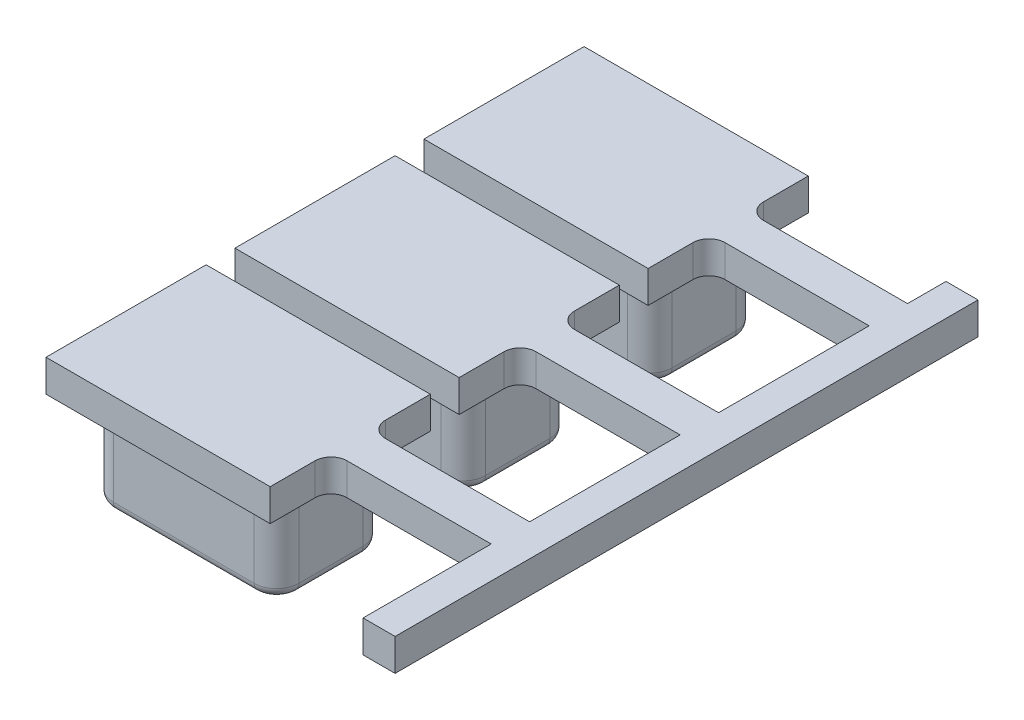
from build123d import *

# Parameters (mm, degrees)
EXTRUDE_1_DEPTH   = 4
EXTRUDE_1_2_DEPTH = 4
EXTRUDE_1_3_DEPTH = 4
SKETCH_2_W        = 7
SKETCH_2_H        = 5
EXTRUDE_2_DEPTH   = 1
SKETCH_3_W        = 6
SKETCH_3_H        = 1.2
EXTRUDE_3_DEPTH   = 1
SKETCH_4_W        = 1
SKETCH_4_H        = 13
EXTRUDE_4_DEPTH   = 1
FILLET_1_R        = 0.5
SKETCH_5_W        = 1
SKETCH_5_H        = 1
EXTRUDE_5_DEPTH   = 1.2
FILLET_2_R        = 0.3
SKETCH_7_W        = 1
SKETCH_7_H        = 1
EXTRUDE_6_DEPTH   = 4


with BuildPart() as part:
    # 草图1 → 凸台-拉伸1 (new body)
    with BuildSketch(Plane(origin=(0, 0, 0), x_dir=(1, 0, 0), z_dir=(0, 1, 0))):
        with BuildLine():
            Line((-2.2, 1.7), (2.2, 1.7))
            ThreePointArc((2.2, 1.7), (2.694974747, 1.494974747), (2.9, 1))
            Line((2.9, 1), (2.9, -1))
            ThreePointArc((2.9, -1), (2.694974747, -1.494974747), (2.2, -1.7))
            Line((2.2, -1.7), (-2.2, -1.7))
            ThreePointArc((-2.2, -1.7), (-2.694974747, -1.494974747), (-2.9, -1))
            Line((-2.9, -1), (-2.9, 1))
            ThreePointArc((-2.9, 1), (-2.694974747, 1.494974747), (-2.2, 1.7))
        make_face()
    extrude(amount=EXTRUDE_1_DEPTH)



with BuildPart() as body_2:
    # 草图1 → Extrude 1 2 (new body)
    with BuildSketch(Plane(origin=(0, 0, 0), x_dir=(1, 0, 0), z_dir=(0, 1, 0))):
        with BuildLine():
            Line((-2.2, 7.528722779), (2.2, 7.528722779))
            ThreePointArc((2.2, 7.528722779), (2.694974747, 7.323697526), (2.9, 6.828722779))
            Line((2.9, 6.828722779), (2.9, 4.828722779))
            ThreePointArc((2.9, 4.828722779), (2.694974747, 4.333748032), (2.2, 4.128722779))
            Line((2.2, 4.128722779), (-2.2, 4.128722779))
            ThreePointArc((-2.2, 4.128722779), (-2.694974747, 4.333748032), (-2.9, 4.828722779))
            Line((-2.9, 4.828722779), (-2.9, 6.828722779))
            ThreePointArc((-2.9, 6.828722779), (-2.694974747, 7.323697526), (-2.2, 7.528722779))
        make_face()
    extrude(amount=EXTRUDE_1_2_DEPTH)


with BuildPart() as body_3:
    # 草图1 → Extrude 1 3 (new body)
    with BuildSketch(Plane(origin=(0, 0, 0), x_dir=(1, 0, 0), z_dir=(0, 1, 0))):
        with BuildLine():
            Line((-2.2, 13.349128593), (2.2, 13.349128593))
            ThreePointArc((2.2, 13.349128593), (2.694974747, 13.144103339), (2.9, 12.649128593))
            Line((2.9, 12.649128593), (2.9, 10.649128593))
            ThreePointArc((2.9, 10.649128593), (2.694974747, 10.154153846), (2.2, 9.949128593))
            Line((2.2, 9.949128593), (-2.2, 9.949128593))
            ThreePointArc((-2.2, 9.949128593), (-2.694974747, 10.154153846), (-2.9, 10.649128593))
            Line((-2.9, 10.649128593), (-2.9, 12.649128593))
            ThreePointArc((-2.9, 12.649128593), (-2.694974747, 13.144103339), (-2.2, 13.349128593))
        make_face()
    extrude(amount=EXTRUDE_1_3_DEPTH)


with BuildPart() as part_1:
    add(part.part)

    add(body_2.part)  # 凸台-拉伸2 merges body 2

    add(body_3.part)  # 凸台-拉伸2 merges body 3
    # 草图2 → 凸台-拉伸2 (add)
    with BuildSketch(Plane(origin=(0, 4, 0), x_dir=(1, 0, 0), z_dir=(0, 1, 0))):
        with Locations((0.036699987, 11.763062551)):
            Rectangle(SKETCH_2_W, SKETCH_2_H)
        with Locations((0.036699987, 5.863062551)):
            Rectangle(SKETCH_2_W, SKETCH_2_H)
        with Locations((0.036699987, -0.036937449)):
            Rectangle(SKETCH_2_W, SKETCH_2_H)
    extrude(amount=-EXTRUDE_2_DEPTH)

    # 草图3 → 凸台-拉伸3 (add)
    with BuildSketch(Plane(origin=(0, 4, 0), x_dir=(1, 0, 0), z_dir=(0, 1, 0))):
        with Locations((6.536699987, 11.763062551)):
            Rectangle(SKETCH_3_W, SKETCH_3_H)
        with Locations((6.536699987, 5.863062551)):
            Rectangle(SKETCH_3_W, SKETCH_3_H)
        with Locations((6.536699987, -0.036937449)):
            Rectangle(SKETCH_3_W, SKETCH_3_H)
    extrude(amount=-EXTRUDE_3_DEPTH)

    # 草图4 → 凸台-拉伸4 (add)
    with BuildSketch(Plane.XZ.offset(-3)):
        with Locations((9.036699987, -5.863062551)):
            Rectangle(SKETCH_4_W, SKETCH_4_H)
    extrude(amount=-EXTRUDE_4_DEPTH)

    # 圆角1
    fillet_1_edges = [part_1.edges().sort_by_distance(p)[0] for p in [
        (3.536699987, 3.5, -12.363062551),
        (3.536699987, 3.5, -11.163062551),
        (3.536699987, 3.5, -5.263062551),
        (3.536699987, 3.5, -6.463062551),
        (3.536699987, 3.5, 0.636937449),
        (3.536699987, 3.5, -0.563062551),
    ]]
    fillet(fillet_1_edges, radius=FILLET_1_R)

    # 草图5 → 凸台-拉伸5 (add)
    with BuildSketch(Plane(origin=(0, 0, -12.363062551), x_dir=(-1, 0, 0), z_dir=(0, 0, -1))):
        with Locations((-9.036699987, 3.5)):
            Rectangle(SKETCH_5_W, SKETCH_5_H)
    extrude(amount=EXTRUDE_5_DEPTH)

    # 圆角2
    fillet_2_edges = [part_1.edges().sort_by_distance(p)[0] for p in [
        (2.694974747, 0, -13.144103339),
        (2.9, 0, -11.649128593),
        (2.694974747, 0, -10.154153846),
        (0, 0, -9.949128593),
        (-2.694974747, 0, -10.154153846),
        (-2.9, 0, -11.649128593),
        (-2.694974747, 0, -13.144103339),
        (2.694974747, 0, -7.323697526),
        (2.9, 0, -5.828722779),
        (2.694974747, 0, -4.333748032),
        (0, 0, -4.128722779),
        (-2.694974747, 0, -4.333748032),
        (-2.9, 0, -5.828722779),
        (-2.694974747, 0, -7.323697526),
        (2.694974747, 0, -1.494974747),
        (2.9, 0, 0),
        (2.694974747, 0, 1.494974747),
        (0, 0, 1.7),
        (-2.694974747, 0, 1.494974747),
        (-2.9, 0, 0),
        (-2.694974747, 0, -1.494974747),
        (0, 0, -13.349128593),
        (0, 0, -7.528722779),
        (0, 0, -1.7),
    ]]
    fillet(fillet_2_edges, radius=FILLET_2_R)

    # 草图7 → 凸台-拉伸6 (add)
    with BuildSketch(Plane.XY.offset(0.636937449)):
        with Locations((9.036699987, 3.5)):
            Rectangle(SKETCH_7_W, SKETCH_7_H)
    extrude(amount=EXTRUDE_6_DEPTH)


solid = part_1.part
